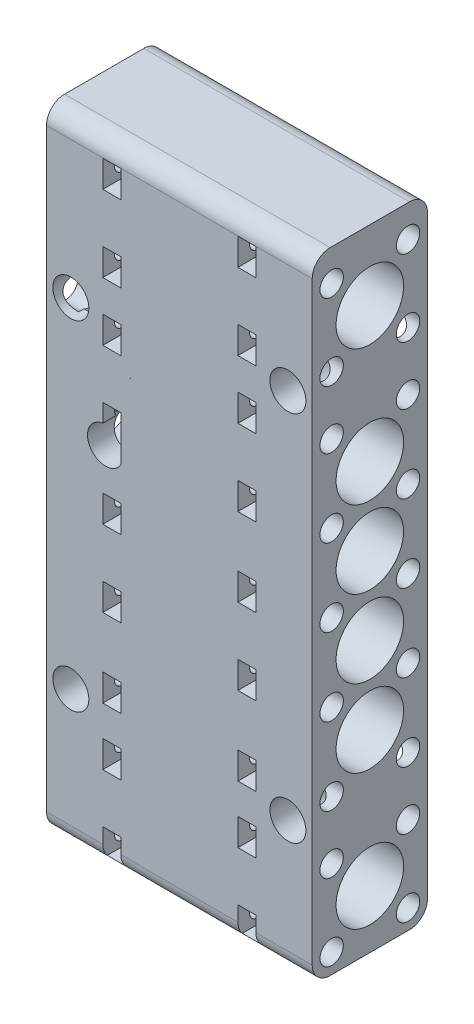
from build123d import *

# Parameters (mm, degrees)
ESQUISSE1_W                  = 59
ESQUISSE1_H                  = 140
ESQUISSE1_R                  = 4
BOSS_EXTRU_1_DEPTH           = 25.6
ESQUISSE2_R                  = 7.5
ESQUISSE2_R_2                = 2.6
ENL_V_MAT_EXTRU_1_DEPTH      = 5
ESQUISSE3_R                  = 7.5
ENL_V_MAT_EXTRU_2_DEPTH      = 82
ENL_V_START                  = -5
ESQUISSE4_R                  = 2.6
ENL_V_MAT_EXTRU_3_DEPTH      = 5
ESQUISSE5_R                  = 1.7
ENL_V_MAT_EXTRU_4_DEPTH      = 71
ENL_V_MAT_EXTRU_5_DEPTH      = 17
ENL_V_MAT_EXTRU_5_DEPTH_BACK = 17
BOSS_EXTRU_2_DEPTH           = 13
BOSS_EXTRU_2_DEPTH_BACK      = 13
ESQUISSE8_W                  = 25.6
ESQUISSE8_H                  = 140
ENL_V_MAT_EXTRU_6_DEPTH      = 33
ENL_V_MAT_EXTRU_6_DEPTH_BACK = 33
ESQUISSE9_R                  = 7.5
ESQUISSE9_R_2                = 1.7
CONG_1_R                     = 4


with BuildPart() as part:
    # Esquisse1 → Boss.-Extru.1 (new body)
    with BuildSketch(Plane.XY):
        with Locations((91.26696752, -67.893899255)):
            Rectangle(ESQUISSE1_W, ESQUISSE1_H)
        with Locations((115.36696752, -108.722960996)):
            Circle(ESQUISSE1_R, mode=Mode.SUBTRACT)
        with Locations((115.36696752, -26.122960996)):
            Circle(ESQUISSE1_R, mode=Mode.SUBTRACT)
        with Locations((74.86696752, -56.866619083)):
            Circle(ESQUISSE1_R, mode=Mode.SUBTRACT)
        with Locations((67.16696752, -107.582960996)):
            Circle(ESQUISSE1_R, mode=Mode.SUBTRACT)
        with Locations((67.16696752, -32.342960996)):
            Circle(ESQUISSE1_R, mode=Mode.SUBTRACT)
    extrude(amount=BOSS_EXTRU_1_DEPTH)

    # Esquisse2 → Enlèv. mat.-Extru.1 (cut)
    with BuildSketch(Plane(origin=(120.76696752, 0, 0), x_dir=(0, 0, -1), z_dir=(1, 0, 0))):
        with Locations((-12.8, -95.02835166)):
            Circle(ESQUISSE2_R)
        with Locations((-21.285281374, -103.629375049)):
            Circle(ESQUISSE2_R_2)
        with Locations(Location((-4.314718626, -103.629375049, 0), (0, 0, 334.638907317))):
            Circle(ESQUISSE2_R_2)
        with Locations((-4.314718626, -86.427328272)):
            Circle(ESQUISSE2_R_2)
        with Locations(Location((-21.285281374, -86.427328272, 0), (0, 0, 180))):
            Circle(ESQUISSE2_R_2)
        with Locations((-21.285281374, -133.513633034)):
            Circle(ESQUISSE2_R_2)
        with Locations((-12.8, -125.02835166)):
            Circle(ESQUISSE2_R)
        with Locations(Location((-4.314718626, -133.513633034, 0), (0, 0, 180))):
            Circle(ESQUISSE2_R_2)
        with Locations((-4.314718626, -69.225281495)):
            Circle(ESQUISSE2_R_2)
        with Locations(Location((-21.285281374, -69.225281495, 0), (0, 0, 180))):
            Circle(ESQUISSE2_R_2)
        with Locations(Location((-12.8, -77.826304883, 0), (0, 0, 180))):
            Circle(ESQUISSE2_R)
        with Locations(Location((-4.314718626, -52.023234718, 0), (0, 0, 180))):
            Circle(ESQUISSE2_R_2)
        with Locations((-21.285281374, -52.023234718)):
            Circle(ESQUISSE2_R_2)
        with Locations((-12.8, -60.624258106)):
            Circle(ESQUISSE2_R)
        with Locations(Location((-4.314718626, -34.821187941, 0), (0, 0, 180))):
            Circle(ESQUISSE2_R_2)
        with Locations((-21.285281374, -34.821187941)):
            Circle(ESQUISSE2_R_2)
        with Locations(Location((-12.8, -43.422211329, 0), (0, 0, 180))):
            Circle(ESQUISSE2_R)
        with Locations(Location((-12.8, -13.422211329, 0), (0, 0, 180))):
            Circle(ESQUISSE2_R)
        with Locations((-21.285281374, -4.936929955)):
            Circle(ESQUISSE2_R_2)
        with Locations(Location((-4.314718626, -4.936929955, 0), (0, 0, 180))):
            Circle(ESQUISSE2_R_2)
        with Locations((-4.314718626, -116.543070286)):
            Circle(ESQUISSE2_R_2)
        with Locations(Location((-21.285281374, -116.543070286, 0), (0, 0, 180))):
            Circle(ESQUISSE2_R_2)
        with Locations((-4.314718626, -21.907492704)):
            Circle(ESQUISSE2_R_2)
        with Locations(Location((-21.285281374, -21.907492704, 0), (0, 0, 354.802791752))):
            Circle(ESQUISSE2_R_2)
    extrude(amount=-ENL_V_MAT_EXTRU_1_DEPTH, mode=Mode.SUBTRACT)

    # Esquisse3 → Enlèv. mat.-Extru.2 (cut)
    with BuildSketch(Plane(origin=(120.76696752, 0, 0), x_dir=(0, 0, -1), z_dir=(1, 0, 0))):
        with Locations((-12.8, -125.02835166)):
            Circle(ESQUISSE3_R)
        with Locations((-12.8, -95.02835166)):
            Circle(ESQUISSE3_R)
        with Locations((-12.8, -77.826304883)):
            Circle(ESQUISSE3_R)
        with Locations((-12.8, -60.624258106)):
            Circle(ESQUISSE3_R)
        with Locations((-12.8, -43.422211329)):
            Circle(ESQUISSE3_R)
        with Locations((-12.8, -13.422211329)):
            Circle(ESQUISSE3_R)
    extrude(amount=-ENL_V_MAT_EXTRU_2_DEPTH, mode=Mode.SUBTRACT)

    # Esquisse4 → Enlèv. mat.-Extru.3 (cut)
    with BuildSketch(Plane.ZY.offset(-61.76696752).offset(ENL_V_START)):
        with Locations(Location((21.285281374, -4.936929955, 0), (0, 0, 180))):
            Circle(ESQUISSE4_R)
        with Locations((4.314718626, -4.936929955)):
            Circle(ESQUISSE4_R)
        with Locations((21.285281374, -34.936929955)):
            Circle(ESQUISSE4_R)
        with Locations(Location((4.314718626, -34.936929955, 0), (0, 0, 327.786913533))):
            Circle(ESQUISSE4_R)
        with Locations((4.314718626, -51.907492704)):
            Circle(ESQUISSE4_R)
        with Locations(Location((21.285281374, -51.907492704, 0), (0, 0, 180))):
            Circle(ESQUISSE4_R)
        with Locations(Location((4.314718626, -69.341023509, 0), (0, 0, 180))):
            Circle(ESQUISSE4_R)
        with Locations((21.285281374, -69.341023509)):
            Circle(ESQUISSE4_R)
        with Locations((4.314718626, -86.311586257)):
            Circle(ESQUISSE4_R)
        with Locations(Location((21.285281374, -86.311586257, 0), (0, 0, 180))):
            Circle(ESQUISSE4_R)
        with Locations(Location((4.314718626, -103.745117063, 0), (0, 0, 3.133124115))):
            Circle(ESQUISSE4_R)
        with Locations((21.285281374, -103.745117063)):
            Circle(ESQUISSE4_R)
        with Locations((4.314718626, -133.513633034)):
            Circle(ESQUISSE4_R)
        with Locations(Location((21.285281374, -133.513633034, 0), (0, 0, 180))):
            Circle(ESQUISSE4_R)
        with Locations(Location((4.314718626, -21.907492704, 0), (0, 0, 180))):
            Circle(ESQUISSE4_R)
        with Locations(Location((21.285281374, -21.907492704, 0), (0, 0, 185.197208248))):
            Circle(ESQUISSE4_R)
        with Locations(Location((4.314718626, -116.543070286, 0), (0, 0, 180))):
            Circle(ESQUISSE4_R)
        with Locations((21.285281374, -116.543070286)):
            Circle(ESQUISSE4_R)
    extrude(amount=ENL_V_MAT_EXTRU_3_DEPTH, mode=Mode.SUBTRACT)

    # Esquisse5 → Enlèv. mat.-Extru.4 (cut)
    with BuildSketch(Plane.ZY.offset(-61.76696752)):
        with Locations((21.285281374, -4.936929955)):
            Circle(ESQUISSE5_R)
        with Locations((21.285281374, -21.907492704)):
            Circle(ESQUISSE5_R)
        with Locations((21.285281374, -34.936929955)):
            Circle(ESQUISSE5_R)
        with Locations((21.285281374, -51.907492704)):
            Circle(ESQUISSE5_R)
        with Locations((21.285281374, -69.341023509)):
            Circle(ESQUISSE5_R)
        with Locations((21.285281374, -86.311586257)):
            Circle(ESQUISSE5_R)
        with Locations((21.285281374, -103.745117063)):
            Circle(ESQUISSE5_R)
        with Locations((21.285281374, -116.543070286)):
            Circle(ESQUISSE5_R)
        with Locations((21.285281374, -133.513633034)):
            Circle(ESQUISSE5_R)
        with Locations((4.314718626, -4.936929955)):
            Circle(ESQUISSE5_R)
        with Locations((4.314718626, -21.907492704)):
            Circle(ESQUISSE5_R)
        with Locations((4.314718626, -34.936929955)):
            Circle(ESQUISSE5_R)
        with Locations((4.314718626, -51.907492704)):
            Circle(ESQUISSE5_R)
        with Locations((4.314718626, -69.341023509)):
            Circle(ESQUISSE5_R)
        with Locations((4.314718626, -86.311586257)):
            Circle(ESQUISSE5_R)
        with Locations((4.314718626, -103.745117063)):
            Circle(ESQUISSE5_R)
        with Locations((4.314718626, -116.543070286)):
            Circle(ESQUISSE5_R)
        with Locations((4.314718626, -133.513633034)):
            Circle(ESQUISSE5_R)
    extrude(amount=-ENL_V_MAT_EXTRU_4_DEPTH, mode=Mode.SUBTRACT)

    # Esquisse6 → Enlèv. mat.-Extru.5 (cut, two sides: drawn at the far end of the back side and taken through both)
    with BuildSketch(Plane.ZY.offset(-91.26696752).offset(-ENL_V_MAT_EXTRU_5_DEPTH_BACK)):
        with BuildLine():
            Line((21.285281374, -1.936929955), (29.285281374, -1.936929955))
            ThreePointArc((29.285281374, -1.936929955), (32.285281374, -4.936929955), (29.285281374, -7.936929955))
            Line((29.285281374, -7.936929955), (21.285281374, -7.936929955))
            ThreePointArc((21.285281374, -7.936929955), (18.285281374, -4.936929955), (21.285281374, -1.936929955))
        make_face()
        with BuildLine():
            Line((21.285281374, -18.907492704), (29.285281374, -18.907492704))
            ThreePointArc((29.285281374, -18.907492704), (32.285281374, -21.907492704), (29.285281374, -24.907492704))
            Line((29.285281374, -24.907492704), (21.285281374, -24.907492704))
            ThreePointArc((21.285281374, -24.907492704), (18.285281374, -21.907492704), (21.285281374, -18.907492704))
        make_face()
        with BuildLine():
            Line((21.285281374, -31.936929955), (29.285281374, -31.936929955))
            ThreePointArc((29.285281374, -31.936929955), (32.285281374, -34.936929955), (29.285281374, -37.936929955))
            Line((29.285281374, -37.936929955), (21.285281374, -37.936929955))
            ThreePointArc((21.285281374, -37.936929955), (18.285281374, -34.936929955), (21.285281374, -31.936929955))
        make_face()
        with BuildLine():
            Line((21.285281374, -48.907492704), (29.285281374, -48.907492704))
            ThreePointArc((29.285281374, -48.907492704), (32.285281374, -51.907492704), (29.285281374, -54.907492704))
            Line((29.285281374, -54.907492704), (21.285281374, -54.907492704))
            ThreePointArc((21.285281374, -54.907492704), (18.285281374, -51.907492704), (21.285281374, -48.907492704))
        make_face()
        with BuildLine():
            Line((21.285281374, -66.341023509), (29.285281374, -66.341023509))
            ThreePointArc((29.285281374, -66.341023509), (32.285281374, -69.341023509), (29.285281374, -72.341023509))
            Line((29.285281374, -72.341023509), (21.285281374, -72.341023509))
            ThreePointArc((21.285281374, -72.341023509), (18.285281374, -69.341023509), (21.285281374, -66.341023509))
        make_face()
        with BuildLine():
            Line((21.285281374, -83.311586257), (29.285281374, -83.311586257))
            ThreePointArc((29.285281374, -83.311586257), (32.285281374, -86.311586257), (29.285281374, -89.311586257))
            Line((29.285281374, -89.311586257), (21.285281374, -89.311586257))
            ThreePointArc((21.285281374, -89.311586257), (18.285281374, -86.311586257), (21.285281374, -83.311586257))
        make_face()
        with BuildLine():
            Line((21.285281374, -100.745117063), (29.285281374, -100.745117063))
            ThreePointArc((29.285281374, -100.745117063), (32.285281374, -103.745117063), (29.285281374, -106.745117063))
            Line((29.285281374, -106.745117063), (21.285281374, -106.745117063))
            ThreePointArc((21.285281374, -106.745117063), (18.285281374, -103.745117063), (21.285281374, -100.745117063))
        make_face()
        with BuildLine():
            Line((21.285281374, -113.543070286), (29.285281374, -113.543070286))
            ThreePointArc((29.285281374, -113.543070286), (32.285281374, -116.543070286), (29.285281374, -119.543070286))
            Line((29.285281374, -119.543070286), (21.285281374, -119.543070286))
            ThreePointArc((21.285281374, -119.543070286), (18.285281374, -116.543070286), (21.285281374, -113.543070286))
        make_face()
        with BuildLine():
            Line((21.285281374, -130.513633034), (29.285281374, -130.513633034))
            ThreePointArc((29.285281374, -130.513633034), (32.285281374, -133.513633034), (29.285281374, -136.513633034))
            Line((29.285281374, -136.513633034), (21.285281374, -136.513633034))
            ThreePointArc((21.285281374, -136.513633034), (18.285281374, -133.513633034), (21.285281374, -130.513633034))
        make_face()
        with BuildLine():
            Line((-3.685281374, -1.936929955), (4.314718626, -1.936929955))
            ThreePointArc((4.314718626, -1.936929955), (7.314718626, -4.936929955), (4.314718626, -7.936929955))
            Line((4.314718626, -7.936929955), (-3.685281374, -7.936929955))
            ThreePointArc((-3.685281374, -7.936929955), (-6.685281374, -4.936929955), (-3.685281374, -1.936929955))
        make_face()
        with BuildLine():
            Line((-3.685281374, -18.907492704), (4.314718626, -18.907492704))
            ThreePointArc((4.314718626, -18.907492704), (7.314718626, -21.907492704), (4.314718626, -24.907492704))
            Line((4.314718626, -24.907492704), (-3.685281374, -24.907492704))
            ThreePointArc((-3.685281374, -24.907492704), (-6.685281374, -21.907492704), (-3.685281374, -18.907492704))
        make_face()
        with BuildLine():
            Line((-3.685281374, -31.936929955), (4.314718626, -31.936929955))
            ThreePointArc((4.314718626, -31.936929955), (7.314718626, -34.936929955), (4.314718626, -37.936929955))
            Line((4.314718626, -37.936929955), (-3.685281374, -37.936929955))
            ThreePointArc((-3.685281374, -37.936929955), (-6.685281374, -34.936929955), (-3.685281374, -31.936929955))
        make_face()
        with BuildLine():
            Line((-3.685281374, -48.907492704), (4.314718626, -48.907492704))
            ThreePointArc((4.314718626, -48.907492704), (7.314718626, -51.907492704), (4.314718626, -54.907492704))
            Line((4.314718626, -54.907492704), (-3.685281374, -54.907492704))
            ThreePointArc((-3.685281374, -54.907492704), (-6.685281374, -51.907492704), (-3.685281374, -48.907492704))
        make_face()
        with BuildLine():
            Line((-3.685281374, -66.341023509), (4.314718626, -66.341023509))
            ThreePointArc((4.314718626, -66.341023509), (7.314718626, -69.341023509), (4.314718626, -72.341023509))
            Line((4.314718626, -72.341023509), (-3.685281374, -72.341023509))
            ThreePointArc((-3.685281374, -72.341023509), (-6.685281374, -69.341023509), (-3.685281374, -66.341023509))
        make_face()
        with BuildLine():
            Line((-3.685281374, -83.311586257), (4.314718626, -83.311586257))
            ThreePointArc((4.314718626, -83.311586257), (7.314718626, -86.311586257), (4.314718626, -89.311586257))
            Line((4.314718626, -89.311586257), (-3.685281374, -89.311586257))
            ThreePointArc((-3.685281374, -89.311586257), (-6.685281374, -86.311586257), (-3.685281374, -83.311586257))
        make_face()
        with BuildLine():
            Line((-3.685281374, -100.745117063), (4.314718626, -100.745117063))
            ThreePointArc((4.314718626, -100.745117063), (7.314718626, -103.745117063), (4.314718626, -106.745117063))
            Line((4.314718626, -106.745117063), (-3.685281374, -106.745117063))
            ThreePointArc((-3.685281374, -106.745117063), (-6.685281374, -103.745117063), (-3.685281374, -100.745117063))
        make_face()
        with BuildLine():
            Line((-3.685281374, -113.543070286), (4.314718626, -113.543070286))
            ThreePointArc((4.314718626, -113.543070286), (7.314718626, -116.543070286), (4.314718626, -119.543070286))
            Line((4.314718626, -119.543070286), (-3.685281374, -119.543070286))
            ThreePointArc((-3.685281374, -119.543070286), (-6.685281374, -116.543070286), (-3.685281374, -113.543070286))
        make_face()
        with BuildLine():
            Line((-3.685281374, -130.513633034), (4.314718626, -130.513633034))
            ThreePointArc((4.314718626, -130.513633034), (7.314718626, -133.513633034), (4.314718626, -136.513633034))
            Line((4.314718626, -136.513633034), (-3.685281374, -136.513633034))
            ThreePointArc((-3.685281374, -136.513633034), (-6.685281374, -133.513633034), (-3.685281374, -130.513633034))
        make_face()
    extrude(amount=ENL_V_MAT_EXTRU_5_DEPTH + ENL_V_MAT_EXTRU_5_DEPTH_BACK, mode=Mode.SUBTRACT)

    # Esquisse8 → Boss.-Extru.2 (add, two sides: drawn at the far end of the back side and taken through both)
    with BuildSketch(Plane.ZY.offset(-91.26696752).offset(-BOSS_EXTRU_2_DEPTH_BACK)):
        with Locations((12.8, -67.893899255)):
            Rectangle(ESQUISSE8_W, ESQUISSE8_H)
    extrude(amount=BOSS_EXTRU_2_DEPTH + BOSS_EXTRU_2_DEPTH_BACK)

    # Esquisse9 → Enlèv. mat.-Extru.6 (cut, two sides: drawn at the far end of the back side and taken through both)
    with BuildSketch(Plane.ZY.offset(-91.26696752).offset(-ENL_V_MAT_EXTRU_6_DEPTH_BACK)):
        with Locations(Location((12.8, -125.02835166, 0), (0, 0, 180))):
            Circle(ESQUISSE9_R)
        with Locations(Location((12.8, -95.02835166, 0), (0, 0, 180))):
            Circle(ESQUISSE9_R)
        with Locations(Location((12.8, -77.826304883, 0), (0, 0, 180))):
            Circle(ESQUISSE9_R)
        with Locations(Location((12.8, -60.624258106, 0), (0, 0, 180))):
            Circle(ESQUISSE9_R)
        with Locations(Location((12.8, -43.422211329, 0), (0, 0, 180))):
            Circle(ESQUISSE9_R)
        with Locations(Location((12.8, -13.422211329, 0), (0, 0, 180))):
            Circle(ESQUISSE9_R)
        with Locations((21.285281374, -4.936929955)):
            Circle(ESQUISSE9_R_2)
        with Locations((21.285281374, -21.907492704)):
            Circle(ESQUISSE9_R_2)
        with Locations((21.285281374, -34.936929955)):
            Circle(ESQUISSE9_R_2)
        with Locations((21.285281374, -51.907492704)):
            Circle(ESQUISSE9_R_2)
        with Locations((21.285281374, -69.341023509)):
            Circle(ESQUISSE9_R_2)
        with Locations((21.285281374, -86.311586257)):
            Circle(ESQUISSE9_R_2)
        with Locations((21.285281374, -103.745117063)):
            Circle(ESQUISSE9_R_2)
        with Locations((21.285281374, -116.543070286)):
            Circle(ESQUISSE9_R_2)
        with Locations((21.285281374, -133.513633034)):
            Circle(ESQUISSE9_R_2)
        with Locations((4.314718626, -4.936929955)):
            Circle(ESQUISSE9_R_2)
        with Locations((4.314718626, -21.907492704)):
            Circle(ESQUISSE9_R_2)
        with Locations((4.314718626, -34.936929955)):
            Circle(ESQUISSE9_R_2)
        with Locations((4.314718626, -51.907492704)):
            Circle(ESQUISSE9_R_2)
        with Locations((4.314718626, -69.341023509)):
            Circle(ESQUISSE9_R_2)
        with Locations((4.314718626, -86.311586257)):
            Circle(ESQUISSE9_R_2)
        with Locations((4.314718626, -103.745117063)):
            Circle(ESQUISSE9_R_2)
        with Locations((4.314718626, -116.543070286)):
            Circle(ESQUISSE9_R_2)
        with Locations((4.314718626, -133.513633034)):
            Circle(ESQUISSE9_R_2)
    extrude(amount=ENL_V_MAT_EXTRU_6_DEPTH + ENL_V_MAT_EXTRU_6_DEPTH_BACK, mode=Mode.SUBTRACT)

    # Congé1
    # the kernel refuses this fillet: 4 mm, written as the material it takes off along each edge
    with BuildSketch(Plane(origin=(130.76696752, 2.106100745, 0), x_dir=(0, 0, 1), z_dir=(-1, 0, 0)), Plane(origin=(51.76696752, 2.106100745, 25.6), x_dir=(0, 0, -1), z_dir=(1, 0, 0)), Plane(origin=(130.76696752, -137.893899255, 0), x_dir=(0, 1, 0), z_dir=(-1, 0, 0)), Plane(origin=(51.76696752, -137.893899255, 25.6), x_dir=(0, 1, 0), z_dir=(1, 0, 0))) as cong_1_piece_1:
        with BuildLine():
            CenterArc((CONG_1_R, -CONG_1_R), CONG_1_R, 90, 90)
            Line((0, -CONG_1_R), (0, 0))
            Line((0, 0), (CONG_1_R, 0))
        make_face()
    extrude(amount=79, mode=Mode.SUBTRACT)


solid = part.part
